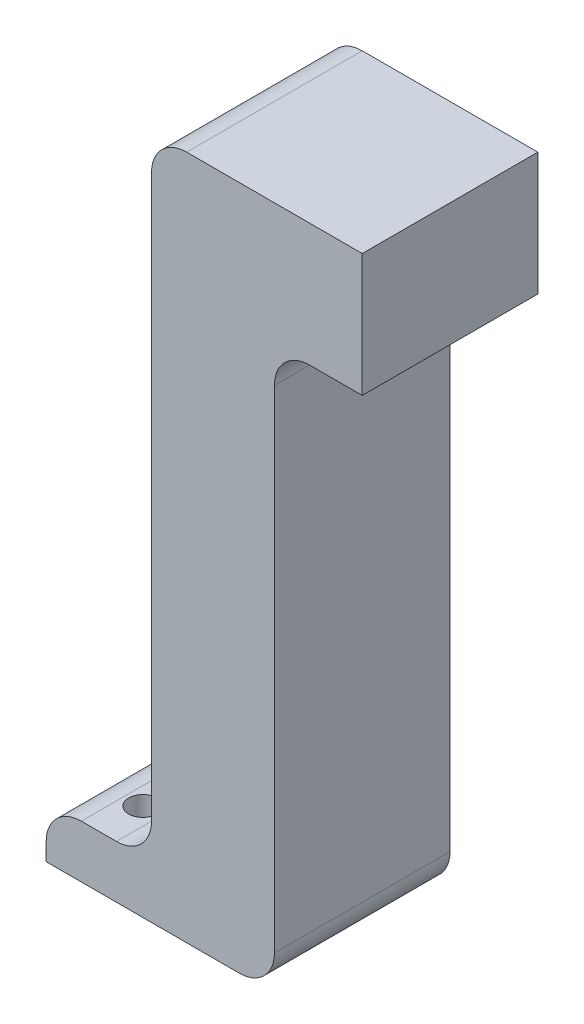
from build123d import *

# Parameters (mm, degrees)
BOSS_EXTRUDE1_DEPTH        = 1.875
BOSS_EXTRUDE1_DEPTH_BACK   = 0.625
FILLET1_R                  = 0.5
F_0_4_0_4_DIAMETER_HOLE1_D = 0.4


with BuildPart() as part:
    # Sketch1 → Boss-Extrude1 (new, two sides: drawn at the far end of the back side and taken through both)
    with BuildSketch(Plane.XY.offset(-BOSS_EXTRUDE1_DEPTH_BACK)):
        Polygon((0.285769435, -7.75), (0.285769435, 0.25), (1.535769435, 0.25), (1.535769435, 2), (-1.464230565, 2), (-1.464230565, -7), (-2.964230565, -7), (-2.964230565, -7.75), align=None)
    extrude(amount=BOSS_EXTRUDE1_DEPTH + BOSS_EXTRUDE1_DEPTH_BACK)

    # Fillet1
    fillet1_edges = [part.edges().sort_by_distance(p)[0] for p in [
        (0.285769435, 0.25, 0.625),
        (-1.464230565, 2, 0.625),
        (-2.964230565, -7, 0.625),
        (0.285769435, -7.75, 0.625),
        (-1.464230565, -7, 0.625),
    ]]
    fillet(fillet1_edges, radius=FILLET1_R)

    # Ø0.4 (0.4) Diameter Hole1 (through all)
    with Locations(Plane(origin=(0, -7, 0), x_dir=(1, 0, 0), z_dir=(0, 1, 0))):
        with Locations((-2.214230565, 0), (-2.214230565, -1.25)):
            Hole(F_0_4_0_4_DIAMETER_HOLE1_D / 2)


solid = part.part
